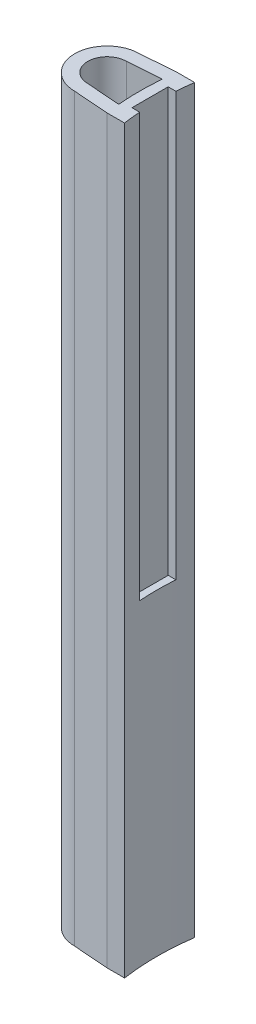
from build123d import *

# Parameters (mm, degrees)
BOSS_EXTRUDE1_DEPTH = 63.33
CUT_EXTRUDE1_START  = -36.188571429
CUT_EXTRUDE1_DEPTH  = 36.188571429


with BuildPart() as part:
    # Sketch2 → Boss-Extrude1 (new body)
    with BuildSketch(Plane(origin=(0, 0, 0), x_dir=(1, 0, 0), z_dir=(0, 1, 0))):
        with BuildLine():
            Line((0, 2.775), (2.975896879, 3))
            Line((2.975896879, 3), (4.490390309, 3))
            ThreePointArc((4.490390309, 3), (4.275, 0), (4.490390309, -3))
            Line((4.490390309, -3), (2.975896879, -3))
            Line((2.975896879, -3), (0, -2.775))
            ThreePointArc((0, -2.775), (-2.775, 0), (0, 2.775))
        make_face()
        with BuildLine():
            Line((0, 1.65), (2.852482762, 1.865668972))
            ThreePointArc((2.852482762, 1.865668972), (2.775, 0), (2.852482762, -1.865668972))
            Line((2.852482762, -1.865668972), (0, -1.65))
            ThreePointArc((0, -1.65), (-1.65, 0), (0, 1.65))
        make_face(mode=Mode.SUBTRACT)
    extrude(amount=BOSS_EXTRUDE1_DEPTH)

    # Sketch3 → Cut-Extrude1 (cut)
    with BuildSketch(Plane(origin=(0, 63.33, 0), x_dir=(1, 0, 0), z_dir=(0, 1, 0)).offset(CUT_EXTRUDE1_START)):
        with BuildLine():
            Line((3.675, 1.55), (4.332280501, 1.55))
            ThreePointArc((4.332280501, 1.55), (4.275, 0), (4.332280501, -1.55))
            Line((4.332280501, -1.55), (3.675, -1.55))
            Line((3.675, -1.55), (3.675, 1.55))
        make_face()
    extrude(amount=CUT_EXTRUDE1_DEPTH, mode=Mode.SUBTRACT)


solid = part.part
